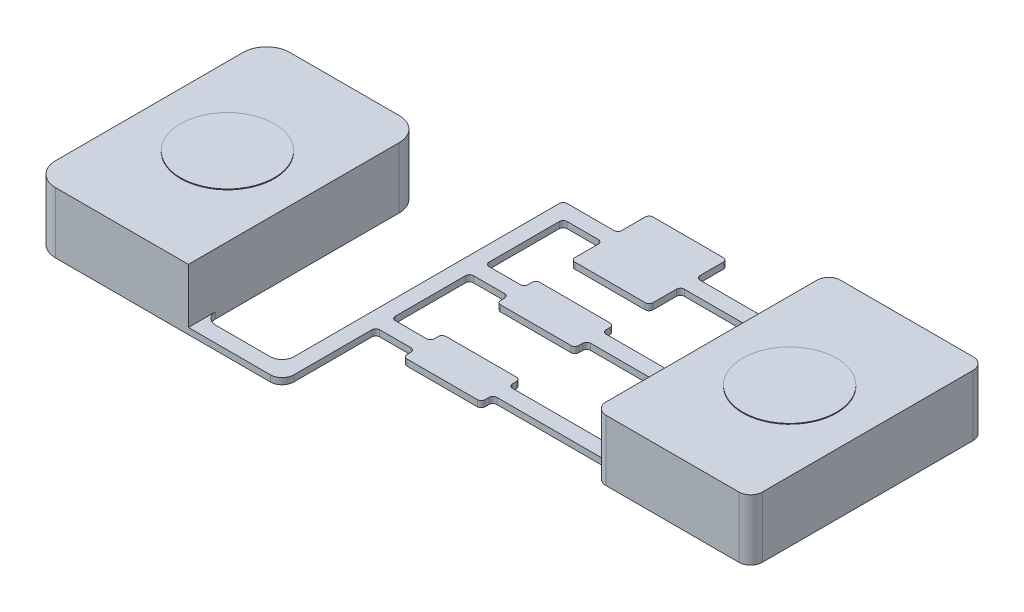
from build123d import *

# Parameters (mm, degrees)
FLUID_DEPTH           = 0.8
RESERVOIR_DEPTH       = 7
SKETCH7_R             = 6
ELECTRODES_DEPTH      = 0.1
ELECTRODES_2_DEPTH    = 0.1
SKETCH14_R            = 1.5
BOSS_EXTRUDE8_DEPTH   = 0.2
BOSS_EXTRUDE8_2_DEPTH = 0.2
BOSS_EXTRUDE8_3_DEPTH = 0.2
SKETCH12_W            = 4
SKETCH12_H            = 4
MEMBRANE_DEPTH        = 0.1
MEMBRANE_2_DEPTH      = 0.1
MEMBRANE_3_DEPTH      = 0.1
BRAIN_SLICE_DEPTH     = 0.3
BRAIN_SLICE_2_DEPTH   = 0.3
BRAIN_SLICE_3_DEPTH   = 0.3


with BuildPart() as part:
    # Sketch10 → fluid (new body)
    with BuildSketch(Plane(origin=(0, 0, 0), x_dir=(1, 0, 0), z_dir=(0, 1, 0))):
        with BuildLine():
            ThreePointArc((-5.5, -12.924390244), (-5.146446609, -13.070836853), (-5, -13.424390244))
            Line((-5, -13.424390244), (-5, -13.924390244))
            ThreePointArc((-5, -13.924390244), (-4.853553391, -14.277943634), (-4.5, -14.424390244))
            Line((-4.5, -14.424390244), (4.5, -14.424390244))
            ThreePointArc((4.5, -14.424390244), (4.853553391, -14.277943634), (5, -13.924390244))
            Line((5, -13.924390244), (5, -13.424390244))
            ThreePointArc((5, -13.424390244), (5.146446609, -13.070836853), (5.5, -12.924390244))
            Line((5.5, -12.924390244), (20, -12.924390244))
            Line((20, -12.924390244), (20, -13.424390244))
            ThreePointArc((20, -13.424390244), (20.439339828, -14.485050416), (21.5, -14.924390244))
            Line((21.5, -14.924390244), (38.5, -14.924390244))
            ThreePointArc((38.5, -14.924390244), (39.560660172, -14.485050416), (40, -13.424390244))
            Line((40, -13.424390244), (40, 13.575609756))
            ThreePointArc((40, 13.575609756), (39.560660172, 14.636269928), (38.5, 15.075609756))
            Line((38.5, 15.075609756), (21.5, 15.075609756))
            ThreePointArc((21.5, 15.075609756), (20.439339828, 14.636269928), (20, 13.575609756))
            Line((20, 13.575609756), (20, 13.075609756))
            Line((20, 13.075609756), (5.5, 13.075609756))
            ThreePointArc((5.5, 13.075609756), (5.146446609, 13.222056366), (5, 13.575609756))
            Line((5, 13.575609756), (5, 16.575609756))
            ThreePointArc((5, 16.575609756), (4.853553391, 16.929163147), (4.5, 17.075609756))
            Line((4.5, 17.075609756), (-4.5, 17.075609756))
            ThreePointArc((-4.5, 17.075609756), (-4.853553391, 16.929163147), (-5, 16.575609756))
            Line((-5, 16.575609756), (-5, 13.575609756))
            ThreePointArc((-5, 13.575609756), (-5.146446609, 13.222056366), (-5.5, 13.075609756))
            Line((-5.5, 13.075609756), (-10.5, 13.075609756))
            Line((-10.5, 13.075609756), (-11.5, 13.075609756))
            ThreePointArc((-11.5, 13.075609756), (-11.853553391, 12.929163147), (-12, 12.575609756))
            Line((-12, 12.575609756), (-12, 11.575609756))
            Line((-12, 11.575609756), (-12, -0.455834786))
            Line((-12, -0.455834786), (-12, -21.424390244))
            ThreePointArc((-12, -21.424390244), (-12.439339828, -22.485050416), (-13.5, -22.924390244))
            Line((-13.5, -22.924390244), (-20.5, -22.924390244))
            ThreePointArc((-20.5, -22.924390244), (-21.560660172, -22.485050416), (-22, -21.424390244))
            Line((-22, -21.424390244), (-22, 2.075609756))
            ThreePointArc((-22, 2.075609756), (-22.878679656, 4.1969301), (-25, 5.075609756))
            Line((-25, 5.075609756), (-39, 5.075609756))
            ThreePointArc((-39, 5.075609756), (-41.121320344, 4.1969301), (-42, 2.075609756))
            Line((-42, 2.075609756), (-42, -21.924390244))
            ThreePointArc((-42, -21.924390244), (-41.121320344, -24.045710587), (-39, -24.924390244))
            Line((-39, -24.924390244), (-23.322875656, -24.924390244))
            Line((-23.322875656, -24.924390244), (-12, -24.924390244))
            Line((-12, -24.924390244), (-11.5, -24.924390244))
            ThreePointArc((-11.5, -24.924390244), (-10.439339828, -24.485050416), (-10, -23.424390244))
            Line((-10, -23.424390244), (-10, -13.424390244))
            ThreePointArc((-10, -13.424390244), (-9.853553391, -13.070836853), (-9.5, -12.924390244))
            Line((-9.5, -12.924390244), (-5.5, -12.924390244))
        make_face()
        with BuildLine():
            ThreePointArc((-5, -1.924390244), (-4.853553391, -2.277943634), (-4.5, -2.424390244))
            Line((-4.5, -2.424390244), (4.5, -2.424390244))
            ThreePointArc((4.5, -2.424390244), (4.853553391, -2.277943634), (5, -1.924390244))
            Line((5, -1.924390244), (5, -1.424390244))
            ThreePointArc((5, -1.424390244), (5.146446609, -1.070836853), (5.5, -0.924390244))
            Line((5.5, -0.924390244), (19.5, -0.924390244))
            ThreePointArc((19.5, -0.924390244), (19.853553391, -1.070836853), (20, -1.424390244))
            Line((20, -1.424390244), (20, -10.424390244))
            ThreePointArc((20, -10.424390244), (19.853553391, -10.777943634), (19.5, -10.924390244))
            Line((19.5, -10.924390244), (5.5, -10.924390244))
            ThreePointArc((5.5, -10.924390244), (5.146446609, -10.777943634), (5, -10.424390244))
            Line((5, -10.424390244), (5, -9.924390244))
            ThreePointArc((5, -9.924390244), (4.853553391, -9.570836853), (4.5, -9.424390244))
            Line((4.5, -9.424390244), (-4.5, -9.424390244))
            ThreePointArc((-4.5, -9.424390244), (-4.853553391, -9.570836853), (-5, -9.924390244))
            Line((-5, -9.924390244), (-5, -10.424390244))
            ThreePointArc((-5, -10.424390244), (-5.146446609, -10.777943634), (-5.5, -10.924390244))
            Line((-5.5, -10.924390244), (-9.5, -10.924390244))
            ThreePointArc((-9.5, -10.924390244), (-9.853553391, -10.777943634), (-10, -10.424390244))
            Line((-10, -10.424390244), (-10, -1.424390244))
            ThreePointArc((-10, -1.424390244), (-9.853553391, -1.070836853), (-9.5, -0.924390244))
            Line((-9.5, -0.924390244), (-5.5, -0.924390244))
            ThreePointArc((-5.5, -0.924390244), (-5.146446609, -1.070836853), (-5, -1.424390244))
            Line((-5, -1.424390244), (-5, -1.924390244))
        make_face(mode=Mode.SUBTRACT)
        with BuildLine():
            Line((4.5, 2.575609756), (-4.5, 2.575609756))
            ThreePointArc((-4.5, 2.575609756), (-4.853553391, 2.429163147), (-5, 2.075609756))
            Line((-5, 2.075609756), (-5, 1.575609756))
            ThreePointArc((-5, 1.575609756), (-5.146446609, 1.222056366), (-5.5, 1.075609756))
            Line((-5.5, 1.075609756), (-9.5, 1.075609756))
            ThreePointArc((-9.5, 1.075609756), (-9.853553391, 1.222056366), (-10, 1.575609756))
            Line((-10, 1.575609756), (-10, 10.575609756))
            ThreePointArc((-10, 10.575609756), (-9.853553391, 10.929163147), (-9.5, 11.075609756))
            Line((-9.5, 11.075609756), (-5.5, 11.075609756))
            ThreePointArc((-5.5, 11.075609756), (-5.146446609, 10.929163147), (-5, 10.575609756))
            Line((-5, 10.575609756), (-5, 7.575609756))
            ThreePointArc((-5, 7.575609756), (-4.853553391, 7.222056366), (-4.5, 7.075609756))
            Line((-4.5, 7.075609756), (4.5, 7.075609756))
            ThreePointArc((4.5, 7.075609756), (4.853553391, 7.222056366), (5, 7.575609756))
            Line((5, 7.575609756), (5, 10.575609756))
            ThreePointArc((5, 10.575609756), (5.146446609, 10.929163147), (5.5, 11.075609756))
            Line((5.5, 11.075609756), (19.5, 11.075609756))
            ThreePointArc((19.5, 11.075609756), (19.853553391, 10.929163147), (20, 10.575609756))
            Line((20, 10.575609756), (20, 1.575609756))
            ThreePointArc((20, 1.575609756), (19.853553391, 1.222056366), (19.5, 1.075609756))
            Line((19.5, 1.075609756), (5.5, 1.075609756))
            ThreePointArc((5.5, 1.075609756), (5.146446609, 1.222056366), (5, 1.575609756))
            Line((5, 1.575609756), (5, 2.075609756))
            ThreePointArc((5, 2.075609756), (4.853553391, 2.429163147), (4.5, 2.575609756))
        make_face(mode=Mode.SUBTRACT)
    extrude(amount=FLUID_DEPTH)

    # Sketch11 → reservoir (add)
    with BuildSketch(Plane(origin=(0, 0.8, 0), x_dir=(1, 0, 0), z_dir=(0, 1, 0))):
        with BuildLine():
            Line((-39, 5.075609756), (-25, 5.075609756))
            ThreePointArc((-25, 5.075609756), (-22.878679656, 4.1969301), (-22, 2.075609756))
            Line((-22, 2.075609756), (-22, -24.924390244))
            Line((-22, -24.924390244), (-39, -24.924390244))
            ThreePointArc((-39, -24.924390244), (-41.121320344, -24.045710587), (-42, -21.924390244))
            Line((-42, -21.924390244), (-42, 2.075609756))
            ThreePointArc((-42, 2.075609756), (-41.121320344, 4.1969301), (-39, 5.075609756))
        make_face()
        with BuildLine():
            Line((21.5, 15.075609756), (38.5, 15.075609756))
            ThreePointArc((38.5, 15.075609756), (39.560660172, 14.636269928), (40, 13.575609756))
            Line((40, 13.575609756), (40, -13.424390244))
            ThreePointArc((40, -13.424390244), (39.560660172, -14.485050416), (38.5, -14.924390244))
            Line((38.5, -14.924390244), (21.5, -14.924390244))
            ThreePointArc((21.5, -14.924390244), (20.439339828, -14.485050416), (20, -13.424390244))
            Line((20, -13.424390244), (20, 13.575609756))
            ThreePointArc((20, 13.575609756), (20.439339828, 14.636269928), (21.5, 15.075609756))
        make_face()
    extrude(amount=RESERVOIR_DEPTH)


with BuildPart() as body_2:
    # Sketch7 → electrodes (new body)
    with BuildSketch(Plane(origin=(0, 7.8, 0), x_dir=(1, 0, 0), z_dir=(0, 1, 0))):
        with Locations((-32, -9.924390244)):
            Circle(SKETCH7_R)
    extrude(amount=ELECTRODES_DEPTH)


with BuildPart() as body_3:
    # Sketch7 → electrodes 2 (new body)
    with BuildSketch(Plane(origin=(0, 7.8, 0), x_dir=(1, 0, 0), z_dir=(0, 1, 0))):
        with Locations((30, 0.075609756)):
            Circle(SKETCH7_R)
    extrude(amount=ELECTRODES_2_DEPTH)


with BuildPart() as body_4:
    # Sketch14 → Boss-Extrude8 (new body)
    with BuildSketch(Plane(origin=(0, 0, 0), x_dir=(1, 0, 0), z_dir=(0, 1, 0))):
        Circle(SKETCH14_R)
    extrude(amount=BOSS_EXTRUDE8_DEPTH)


with BuildPart() as body_5:
    # Sketch14 → Boss-Extrude8 2 (new body)
    with BuildSketch(Plane(origin=(0, 0, 0), x_dir=(1, 0, 0), z_dir=(0, 1, 0))):
        with Locations((0, 12)):
            Circle(SKETCH14_R)
    extrude(amount=BOSS_EXTRUDE8_2_DEPTH)


with BuildPart() as body_6:
    # Sketch14 → Boss-Extrude8 3 (new body)
    with BuildSketch(Plane(origin=(0, 0, 0), x_dir=(1, 0, 0), z_dir=(0, 1, 0))):
        with Locations((0, -12)):
            Circle(SKETCH14_R)
    extrude(amount=BOSS_EXTRUDE8_3_DEPTH)


with BuildPart() as body_7:
    # Sketch12 → membrane (new body)
    with BuildSketch(Plane(origin=(0, 0.2, 0), x_dir=(1, 0, 0), z_dir=(0, 1, 0))):
        with Locations((0, -12)):
            Rectangle(SKETCH12_W, SKETCH12_H)
    extrude(amount=MEMBRANE_DEPTH)


with BuildPart() as body_8:
    # Sketch12 → membrane 2 (new body)
    with BuildSketch(Plane(origin=(0, 0.2, 0), x_dir=(1, 0, 0), z_dir=(0, 1, 0))):
        Rectangle(SKETCH12_W, SKETCH12_H)
    extrude(amount=MEMBRANE_2_DEPTH)


with BuildPart() as body_9:
    # Sketch12 → membrane 3 (new body)
    with BuildSketch(Plane(origin=(0, 0.2, 0), x_dir=(1, 0, 0), z_dir=(0, 1, 0))):
        with Locations((0, 12)):
            Rectangle(SKETCH12_W, SKETCH12_H)
    extrude(amount=MEMBRANE_3_DEPTH)


with BuildPart() as body_10:
    # Sketch13 → brain slice (new body)
    with BuildSketch(Plane(origin=(0, 0.3, 0), x_dir=(1, 0, 0), z_dir=(0, 1, 0))):
        with BuildLine():
            add(Edge.make_bspline(
                [(-1.374153713, 0.416057794), (-1.242152842, 0.525566765), (-0.907104093, 0.871094226), (0.109057585, 1.129975764), (1.271319069, 0.83531244), (2.290815749, -0.9246818), (0.683411012, -0.678108899), (-0.163226542, -1.034532607), (-1.019715727, -1.025420635), (-1.564896187, -0.63212273), (-2.108087688, -0.095437294), (-1.599240508, 0.229324001), (-1.374153713, 0.416057794)],
                knots=[0, 0, 0, 0, 0.051934961, 0.170653906, 0.317123498, 0.463290568, 0.601985486, 0.67644339, 0.792471652, 0.855761907, 0.911440933, 1, 1, 1, 1], degree=3))
        make_face()
    extrude(amount=BRAIN_SLICE_DEPTH)


with BuildPart() as body_11:
    # Sketch13 → brain slice 2 (new body)
    with BuildSketch(Plane(origin=(0, 0.3, 0), x_dir=(1, 0, 0), z_dir=(0, 1, 0))):
        with BuildLine():
            add(Edge.make_bspline(
                [(-1.374153713, -11.583942206), (-1.242152842, -11.474433235), (-0.907104093, -11.128905774), (0.109057585, -10.870024236), (1.271319069, -11.16468756), (2.290815749, -12.9246818), (0.683411012, -12.678108899), (-0.163226542, -13.034532607), (-1.019715727, -13.025420635), (-1.564896187, -12.63212273), (-2.108087688, -12.095437294), (-1.599240508, -11.770675999), (-1.374153713, -11.583942206)],
                knots=[0, 0, 0, 0, 0.051934961, 0.170653906, 0.317123498, 0.463290568, 0.601985486, 0.67644339, 0.792471652, 0.855761907, 0.911440933, 1, 1, 1, 1], degree=3))
        make_face()
    extrude(amount=BRAIN_SLICE_2_DEPTH)


with BuildPart() as body_12:
    # Sketch13 → brain slice 3 (new body)
    with BuildSketch(Plane(origin=(0, 0.3, 0), x_dir=(1, 0, 0), z_dir=(0, 1, 0))):
        with BuildLine():
            add(Edge.make_bspline(
                [(-1.374153713, 12.416057794), (-1.242152842, 12.525566765), (-0.907104093, 12.871094226), (0.109057585, 13.129975764), (1.271319069, 12.83531244), (2.290815749, 11.0753182), (0.683411012, 11.321891101), (-0.163226542, 10.965467393), (-1.019715727, 10.974579365), (-1.564896187, 11.36787727), (-2.108087688, 11.904562706), (-1.599240508, 12.229324001), (-1.374153713, 12.416057794)],
                knots=[0, 0, 0, 0, 0.051934961, 0.170653906, 0.317123498, 0.463290568, 0.601985486, 0.67644339, 0.792471652, 0.855761907, 0.911440933, 1, 1, 1, 1], degree=3))
        make_face()
    extrude(amount=BRAIN_SLICE_3_DEPTH)


solid = Compound([part.part, body_2.part, body_3.part, body_4.part, body_5.part, body_6.part, body_7.part, body_8.part, body_9.part, body_10.part, body_11.part, body_12.part])
